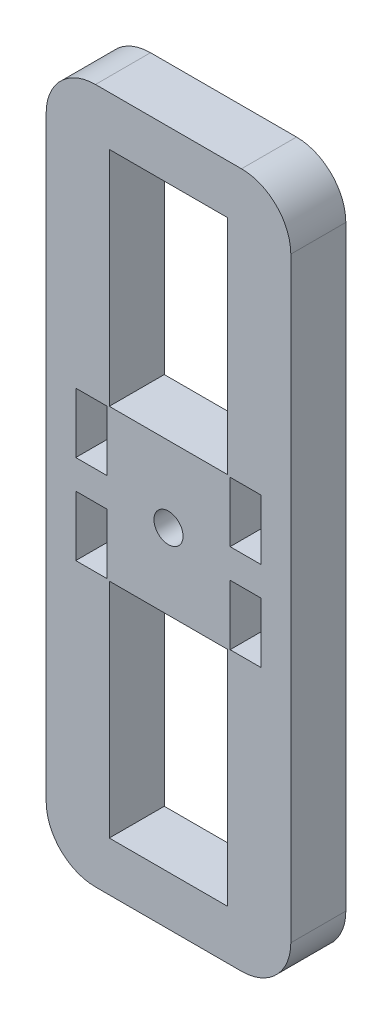
from build123d import *

# Parameters (mm, degrees)
SKETCH1_W           = 3.155
SKETCH1_H           = 6.1
SKETCH1_R           = 1.475
SKETCH1_W_2         = 12.01
SKETCH1_H_2         = 22.57
BOSS_EXTRUDE1_DEPTH = 5.58


with BuildPart() as part:
    # Sketch1 → Boss-Extrude1 (new body)
    with BuildSketch(Plane.XY):
        with BuildLine():
            Line((708.290729089, 432.709671907), (715.695729089, 432.709671907))
            Line((715.695729089, 432.709671907), (723.100729089, 432.709671907))
            ThreePointArc((723.100729089, 432.709671907), (726.636262995, 434.174138001), (728.100729089, 437.709671907))
            Line((728.100729089, 437.709671907), (728.100729089, 498.199671907))
            ThreePointArc((728.100729089, 498.199671907), (726.636262995, 501.735205812), (723.100729089, 503.199671907))
            Line((723.100729089, 503.199671907), (715.695729089, 503.199671907))
            Line((715.695729089, 503.199671907), (708.290729089, 503.199671907))
            ThreePointArc((708.290729089, 503.199671907), (704.755195183, 501.735205812), (703.290729089, 498.199671907))
            Line((703.290729089, 498.199671907), (703.290729089, 437.709671907))
            ThreePointArc((703.290729089, 437.709671907), (704.755195183, 434.174138001), (708.290729089, 432.709671907))
        make_face()
        with Locations((707.868229089, 463.429671907)):
            Rectangle(SKETCH1_W, SKETCH1_H, mode=Mode.SUBTRACT)
        with Locations((715.695729089, 467.954671907)):
            Circle(SKETCH1_R, mode=Mode.SUBTRACT)
        with Locations((715.695729089, 448.994671907)):
            Rectangle(SKETCH1_W_2, SKETCH1_H_2, mode=Mode.SUBTRACT)
        with Locations((723.523229089, 463.429671907)):
            Rectangle(SKETCH1_W, SKETCH1_H, mode=Mode.SUBTRACT)
        with Locations((707.868229089, 472.479671907)):
            Rectangle(SKETCH1_W, SKETCH1_H, mode=Mode.SUBTRACT)
        with Locations((723.523229089, 472.479671907)):
            Rectangle(SKETCH1_W, SKETCH1_H, mode=Mode.SUBTRACT)
        with Locations((715.695729089, 486.914671907)):
            Rectangle(SKETCH1_W_2, SKETCH1_H_2, mode=Mode.SUBTRACT)
    extrude(amount=BOSS_EXTRUDE1_DEPTH)


solid = part.part
